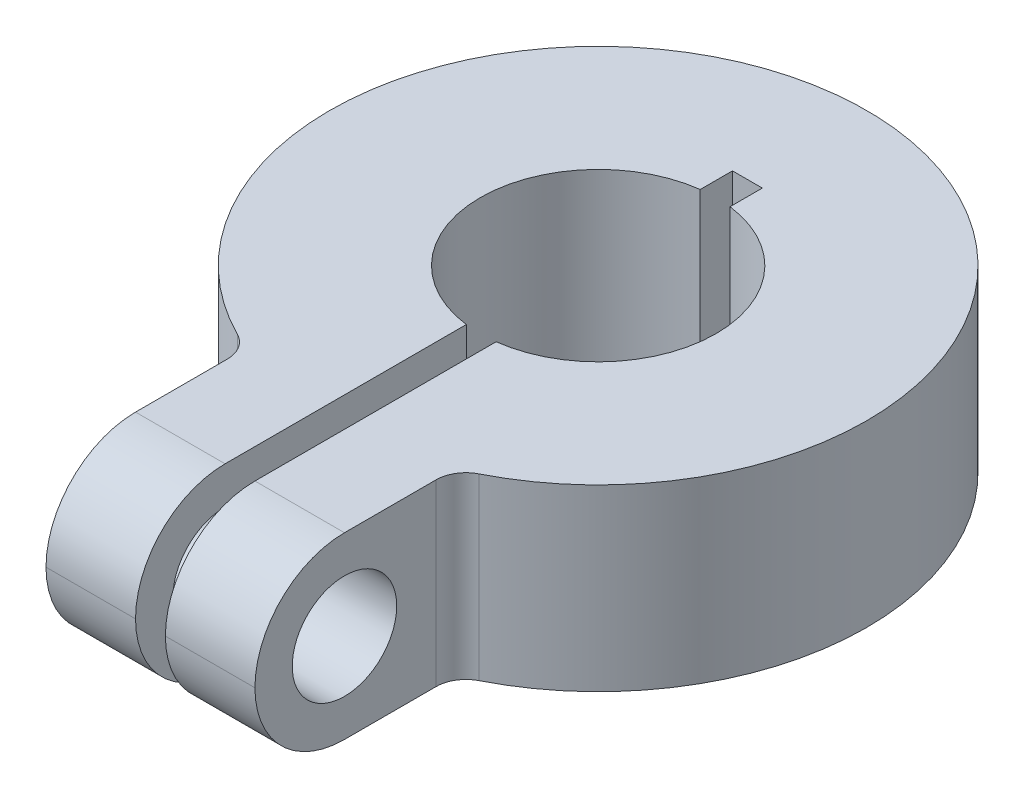
from build123d import *

# Parameters (mm, degrees)
SKETCH1_R           = 3.95
BOSS_EXTRUDE1_DEPTH = 6
SKETCH2_W           = 1
SKETCH2_H           = 20
CUT_EXTRUDE1_DEPTH  = 19.493242009
FILLET1_R           = 3
SKETCH3_R           = 1.75
CUT_EXTRUDE2_DEPTH  = 21.426698216
FILLET2_R           = 1


with BuildPart() as part:
    # Sketch1 → Boss-Extrude1 (new body)
    # profile 1 of 3: a face of its own
    with BuildSketch(Plane(origin=(0, 0, 0), x_dir=(1, 0, 0), z_dir=(0, 1, 0))):
        with BuildLine():
            ThreePointArc((9, 0), (-4.974937186, 7.5), (-3.5, -8.291561976))
            Line((-3.5, -8.291561976), (-3.5, -4))
            Line((-3.5, -4), (3.5, -4))
            Line((3.5, -4), (3.5, -8.291561976))
            ThreePointArc((3.5, -8.291561976), (7.5, -4.974937186), (9, 0))
        make_face()
        with Locations(Location((0, 0, 0), (0, 0, 270))):
            Circle(SKETCH1_R, mode=Mode.SUBTRACT)
    # profile 2 of 3: a face of its own
    with BuildSketch(Plane(origin=(0, 0, 0), x_dir=(1, 0, 0), z_dir=(0, 1, 0))):
        with BuildLine():
            Line((-3.5, -4), (-3.5, -8.291561976))
            ThreePointArc((-3.5, -8.291561976), (0, -9), (3.5, -8.291561976))
            Line((3.5, -8.291561976), (3.5, -4))
            Line((3.5, -4), (-3.5, -4))
        make_face()
    # profile 3 of 3: a face of its own
    with BuildSketch(Plane(origin=(0, 0, 0), x_dir=(1, 0, 0), z_dir=(0, 1, 0))):
        with BuildLine():
            Line((-3.5, -8.291561976), (-3.5, -15))
            Line((-3.5, -15), (3.5, -15))
            Line((3.5, -15), (3.5, -8.291561976))
            ThreePointArc((3.5, -8.291561976), (0, -9), (-3.5, -8.291561976))
        make_face()
    extrude(amount=BOSS_EXTRUDE1_DEPTH)

    # Sketch2 → Cut-Extrude1 (cut, through all)
    with BuildSketch(Plane(origin=(0, 6, 0), x_dir=(1, 0, 0), z_dir=(0, 1, 0))):
        with Locations((0, -5)):
            Rectangle(SKETCH2_W, SKETCH2_H)
    extrude(amount=-CUT_EXTRUDE1_DEPTH, mode=Mode.SUBTRACT)

    # Fillet1
    fillet1_edges = [part.edges().sort_by_distance(p)[0] for p in [
        (-2, 0, 15),
        (-2, 6, 15),
        (2, 6, 15),
        (2, 0, 15),
    ]]
    fillet(fillet1_edges, radius=FILLET1_R - 0.0001)  # a hair under: the kernel refuses the full size

    # Sketch3 → Cut-Extrude2 (cut, through all)
    with BuildSketch(Plane(origin=(3.5, 0, 0), x_dir=(0, 0, -1), z_dir=(1, 0, 0))):
        with Locations((-12, 3)):
            Circle(SKETCH3_R)
    extrude(amount=-CUT_EXTRUDE2_DEPTH, mode=Mode.SUBTRACT)

    # Fillet2
    fillet2_edges = [part.edges().sort_by_distance(p)[0] for p in [
        (3.5, 3, 8.291561976),
        (-3.5, 3, 8.291561976),
    ]]
    fillet(fillet2_edges, radius=FILLET2_R)


solid = part.part
